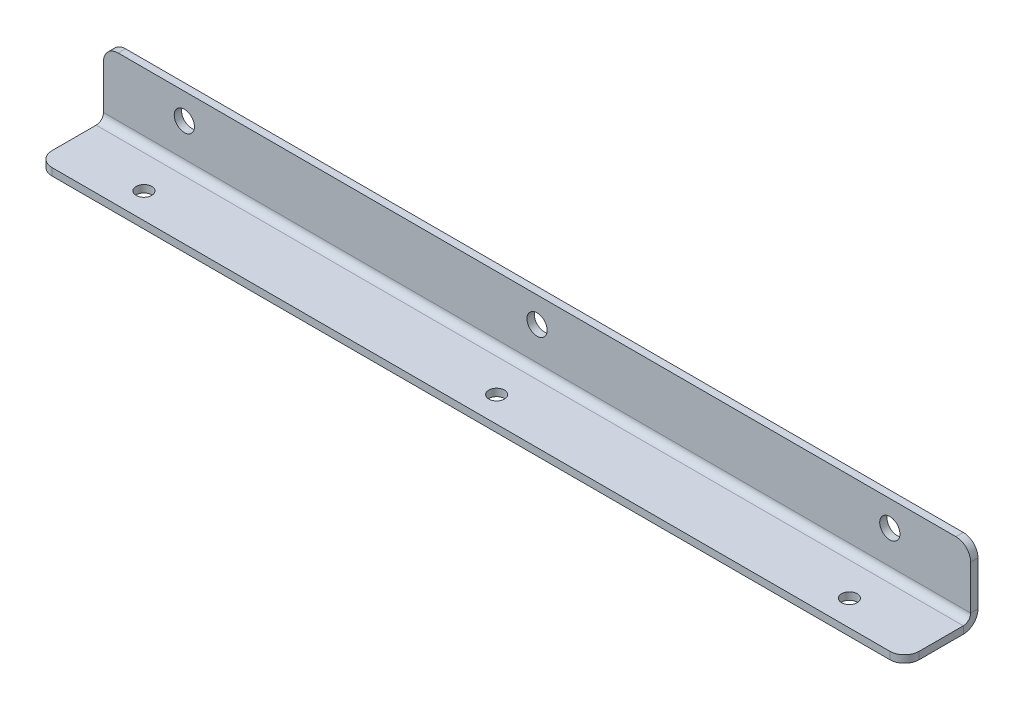
from build123d import *

# Parameters (mm, degrees)
BASE_FLANGE1_DEPTH = 374.65
SKETCH6_R          = 3.3782
CUT_EXTRUDE1_DEPTH = 378.077201147
SKETCH7_R          = 4.3688
CUT_EXTRUDE2_DEPTH = 378.077201147
FILLET1_R          = 6.35


# Sheet-metal steps are written as plain solids
with BuildPart() as part:
    # Sketch1 → Base-Flange1 (new body)
    with BuildSketch(Plane(origin=(0, 0, 0), x_dir=(0, 0, -1), z_dir=(1, 0, 0))):
        with BuildLine():
            Line((0, 0), (25.4, 0))
            ThreePointArc((25.4, 0), (29.890128061, 1.859871939), (31.75, 6.35))
            Line((31.75, 6.35), (31.75, 31.75))
            Line((31.75, 31.75), (28.575, 31.75))
            Line((28.575, 31.75), (28.575, 6.35))
            ThreePointArc((28.575, 6.35), (27.64506403, 4.10493597), (25.4, 3.175))
            Line((25.4, 3.175), (0, 3.175))
            Line((0, 3.175), (0, 0))
        make_face()
    extrude(amount=BASE_FLANGE1_DEPTH)

    # Sketch6 → Cut-Extrude1 (cut, through all)
    with BuildSketch(Plane(origin=(0, 3.175, 0), x_dir=(1, 0, 0), z_dir=(0, 1, 0))):
        with Locations(Location((187.325, 11.1125, 0), (0, 0, 270))):
            Circle(SKETCH6_R)
        with Locations(Location((339.725, 11.1125, 0), (0, 0, 270))):
            Circle(SKETCH6_R)
        with Locations(Location((34.925, 11.1125, 0), (0, 0, 90))):
            Circle(SKETCH6_R)
    extrude(amount=-CUT_EXTRUDE1_DEPTH, mode=Mode.SUBTRACT)

    # Sketch7 → Cut-Extrude2 (cut, through all)
    with BuildSketch(Plane.XY.offset(-28.575)):
        with Locations((187.325, 20.6375)):
            Circle(SKETCH7_R)
        with Locations((339.725, 20.6375)):
            Circle(SKETCH7_R)
        with Locations(Location((34.925, 20.6375, 0), (0, 0, 180))):
            Circle(SKETCH7_R)
    extrude(amount=-CUT_EXTRUDE2_DEPTH, mode=Mode.SUBTRACT)

    # Fillet1
    fillet1_edges = [part.edges().sort_by_distance(p)[0] for p in [
        (374.65, 1.5875, 0),
        (0, 1.5875, 0),
        (374.65, 31.75, -30.1625),
        (0, 31.75, -30.1625),
    ]]
    fillet(fillet1_edges, radius=FILLET1_R)


solid = part.part
